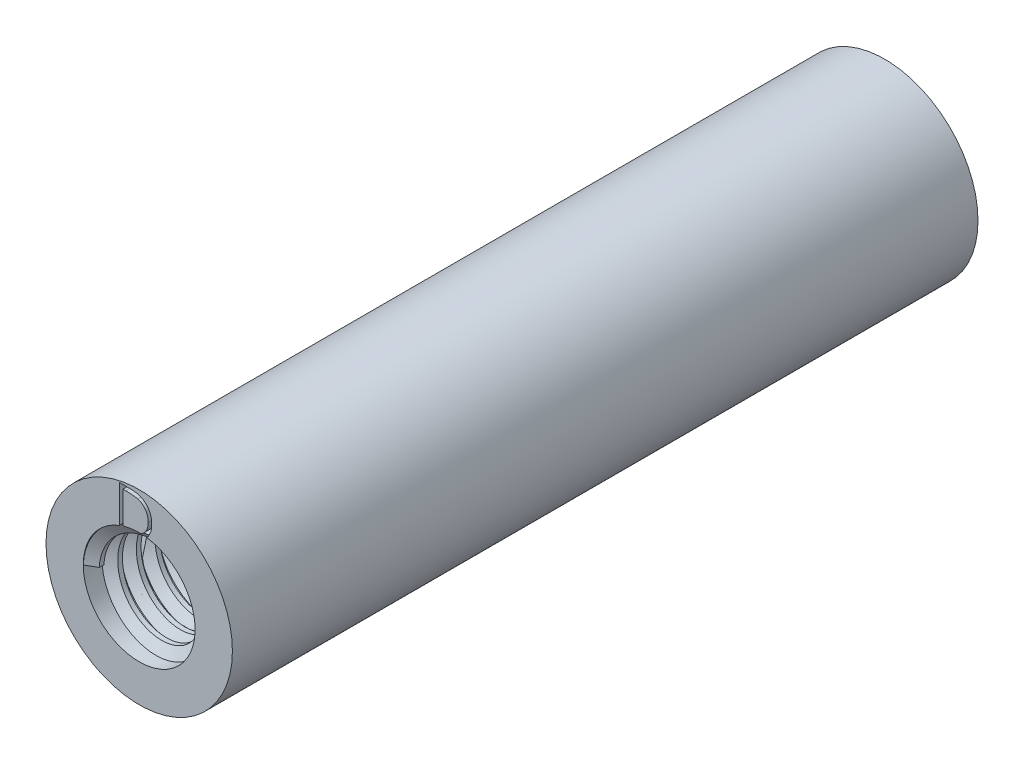
from build123d import *

# Parameters (mm, degrees)
ESQUISSE1_R             = 5
ESQUISSE1_R_2           = 3
BOSS_EXTRU_1_DEPTH      = 40
FILETAGE1_PITCH         = 1
FILETAGE2_PITCH         = 1
ENL_V_MAT_EXTRU_1_DEPTH = 1
ENL_V_MAT_EXTRU_2_DEPTH = 1


with BuildPart() as part:
    # Esquisse1 → Boss.-Extru.1 (new body)
    with BuildSketch(Plane.XY):
        Circle(ESQUISSE1_R)
        Circle(ESQUISSE1_R_2, mode=Mode.SUBTRACT)
    extrude(amount=BOSS_EXTRU_1_DEPTH)

    # Filetage1: the profile of Profil de filetage1 profile screwed along a right-hand helix of 20 turns, 8 arcs to a turn; built about Z, then put on its axis
    filetage1_z = Axis((0, 0, 0), (0, 0, 1))
    filetage1_corners = [(3.0003, 0, -0.000173205), (3.0003, 0, 0.875173202), (2.458734125, 0, 0.562499999), (2.458734125, 0, 0.312499999)]
    with BuildLine(mode=Mode.PRIVATE) as filetage1_profile:
        Line(filetage1_corners[0], filetage1_corners[1])
        Line(filetage1_corners[1], filetage1_corners[2])
        Line(filetage1_corners[2], filetage1_corners[3])
        Line(filetage1_corners[3], filetage1_corners[0])
    filetage1_cap = Face(filetage1_profile.wire())
    filetage1_turn_angles = [0, 22.5, 45, 67.5, 90, 112.5, 135, 157.5, 180, 202.5, 225, 247.5, 270, 292.5, 315, 337.5, 360]
    filetage1_turn_weights = [1, 0.9238795325112867, 1, 0.9238795325112867, 1, 0.9238795325112867, 1, 0.9238795325112867, 1, 0.9238795325112867, 1, 0.9238795325112867, 1, 0.9238795325112867, 1, 0.9238795325112867, 1]
    filetage1_turn_rails = [Edge.make_bspline([Vector(p[0], p[1], 0).rotate(filetage1_z, filetage1_turn_angles[k]) / filetage1_turn_weights[k] + Vector(0, 0, p[2] + FILETAGE1_PITCH * filetage1_turn_angles[k] / 360) for k in range(17)], [0, 0, 0, 1, 1, 2, 2, 3, 3, 4, 4, 5, 5, 6, 6, 7, 7, 8, 8, 8], 2, filetage1_turn_weights) for p in filetage1_corners]
    filetage1_turn_sides = [Face.make_surface_from_curves(filetage1_turn_rails[p[0]], filetage1_turn_rails[p[1]]) for p in [(0, 1), (1, 2), (2, 3), (3, 0)]]
    filetage1 = Plane(origin=(0, 0, 40), x_dir=(-1, 0, 0), z_dir=(0, 0, -1)) * Solid(Shell([*[p.moved(Location((0, 0, FILETAGE1_PITCH * i))) for i in range(20) for p in filetage1_turn_sides], filetage1_cap, filetage1_cap.rotate(filetage1_z, 7200).moved(Location((0, 0, FILETAGE1_PITCH * 7200 / 360)))]))
    add(filetage1)

    # Filetage2: the profile of Profil de filetage2 profile screwed along a left-hand helix of 20 turns, 8 arcs to a turn; built about Z, then put on its axis
    filetage2_z = Axis((0, 0, 0), (0, 0, 1))
    filetage2_corners = [(3.0003, 0, -0.000173205), (3.0003, 0, 0.875173202), (2.458734125, 0, 0.562499999), (2.458734125, 0, 0.312499999)]
    with BuildLine(mode=Mode.PRIVATE) as filetage2_profile:
        Line(filetage2_corners[0], filetage2_corners[1])
        Line(filetage2_corners[1], filetage2_corners[2])
        Line(filetage2_corners[2], filetage2_corners[3])
        Line(filetage2_corners[3], filetage2_corners[0])
    filetage2_cap = Face(filetage2_profile.wire())
    filetage2_turn_angles = [0, -22.5, -45, -67.5, -90, -112.5, -135, -157.5, -180, -202.5, -225, -247.5, -270, -292.5, -315, -337.5, -360]
    filetage2_turn_weights = [1, 0.9238795325112867, 1, 0.9238795325112867, 1, 0.9238795325112867, 1, 0.9238795325112867, 1, 0.9238795325112867, 1, 0.9238795325112867, 1, 0.9238795325112867, 1, 0.9238795325112867, 1]
    filetage2_turn_rails = [Edge.make_bspline([Vector(p[0], p[1], 0).rotate(filetage2_z, filetage2_turn_angles[k]) / filetage2_turn_weights[k] + Vector(0, 0, p[2] + -FILETAGE2_PITCH * filetage2_turn_angles[k] / 360) for k in range(17)], [0, 0, 0, 1, 1, 2, 2, 3, 3, 4, 4, 5, 5, 6, 6, 7, 7, 8, 8, 8], 2, filetage2_turn_weights) for p in filetage2_corners]
    filetage2_turn_sides = [Face.make_surface_from_curves(filetage2_turn_rails[p[0]], filetage2_turn_rails[p[1]]) for p in [(0, 1), (1, 2), (2, 3), (3, 0)]]
    filetage2 = Plane(origin=(0, 0, 0), x_dir=(1, 0, 0), z_dir=(0, 0, 1)) * Solid(Shell([*[p.moved(Location((0, 0, FILETAGE2_PITCH * i))) for i in range(20) for p in filetage2_turn_sides], filetage2_cap, filetage2_cap.rotate(filetage2_z, -7200).moved(Location((0, 0, -FILETAGE2_PITCH * -7200 / 360)))]))
    add(filetage2)

    # Esquisse6 → Enlèv. mat.-Extru.1 (cut)
    with BuildSketch(Plane(origin=(0, 0, 0), x_dir=(-1, 0, 0), z_dir=(0, 0, -1))):
        with BuildLine():
            Line((0.930500833, 4.448494922), (0.76768032, 4.294154645))
            add(Edge.make_bspline(
                [(0.76768032, 4.294154645), (0.738216993, 4.321871405), (0.679992907, 4.376644003), (0.585069332, 4.447710176), (0.486031325, 4.508589198), (0.383395672, 4.55812297), (0.27970407, 4.59764583), (0.176332858, 4.625784277), (0.074342363, 4.643729097), (0.006507902, 4.645875016), (-0.026917703, 4.646932422)],
                knots=[0, 0, 0, 0, 1.08915593, 2.152340314, 3.188132944, 4.216796309, 5.218260357, 6.173443236, 7.099959455, 8, 8, 8, 8], degree=3))
            add(Edge.make_bspline(
                [(-0.026917703, 4.646932422), (-0.047428022, 4.646682289), (-0.088395464, 4.646182672), (-0.149247783, 4.639805932), (-0.209461892, 4.6306348), (-0.268924123, 4.617365188), (-0.327750092, 4.600547329), (-0.385735203, 4.579510406), (-0.442987622, 4.554984139), (-0.498968062, 4.5266435), (-0.553239699, 4.49551045), (-0.604497405, 4.461009666), (-0.653067889, 4.424246922), (-0.698038241, 4.384301805), (-0.73966714, 4.341536149), (-0.778945441, 4.296745483), (-0.814491711, 4.248706089), (-0.846599225, 4.198301829), (-0.875241727, 4.146417981), (-0.900526008, 4.093553935), (-0.92175139, 4.039885033), (-0.938545299, 3.985343929), (-0.952400789, 3.930352572), (-0.962148104, 3.874530193), (-0.967643407, 3.817817022), (-0.96859396, 3.779839632), (-0.969071816, 3.760747861)],
                knots=[0, 0, 0, 0, 1.02818874, 2.053710826, 3.065248034, 4.081641283, 5.106893873, 6.131558223, 7.173050175, 8.228653731, 9.27666206, 10.308777013, 11.325269123, 12.329503258, 13.32196095, 14.316845687, 15.314881793, 16.315733098, 17.311955233, 18.285320748, 19.252783886, 20.203351036, 21.145449891, 22.095197417, 23.042428769, 24, 24, 24, 24], degree=3))
            add(Edge.make_bspline(
                [(-0.969071816, 3.760747861), (-0.968614787, 3.7412317), (-0.967701976, 3.70225267), (-0.961859782, 3.644078159), (-0.951017465, 3.586767654), (-0.936522708, 3.530132831), (-0.918391453, 3.474076695), (-0.895789888, 3.418842273), (-0.869019739, 3.364431607), (-0.838033825, 3.311334953), (-0.804054549, 3.259613887), (-0.765988972, 3.210894557), (-0.725554238, 3.164528201), (-0.68127726, 3.121544287), (-0.634577823, 3.080793073), (-0.584060685, 3.043397305), (-0.530719197, 3.008636666), (-0.474471978, 2.976949247), (-0.415929343, 2.948641228), (-0.35590264, 2.923468681), (-0.294200104, 2.902737844), (-0.231146001, 2.885841943), (-0.166815498, 2.871992715), (-0.100882056, 2.863083072), (-0.033830466, 2.856617665), (0.011368612, 2.856144941), (0.034139989, 2.855906781)],
                knots=[0, 0, 0, 0, 0.93586088, 1.869166235, 2.799637598, 3.729985548, 4.670839027, 5.622275134, 6.589130586, 7.576015415, 8.568469353, 9.55398029, 10.53834874, 11.515998671, 12.510579167, 13.508179873, 14.527009472, 15.561807829, 16.601455013, 17.643573243, 18.680854198, 19.719860599, 20.772568776, 21.833555941, 22.908541556, 24, 24, 24, 24], degree=3))
            add(Edge.make_bspline(
                [(0.034139989, 2.855906781), (0.061583085, 2.856480444), (0.115472062, 2.857606924), (0.194687672, 2.866376147), (0.270768577, 2.880072065), (0.343500995, 2.900129536), (0.412969403, 2.925713187), (0.479428468, 2.956553254), (0.542354947, 2.993832628), (0.601938009, 3.035908252), (0.656824497, 3.08278627), (0.706326753, 3.13337125), (0.749655216, 3.187417652), (0.787455677, 3.244607152), (0.818727101, 3.305413123), (0.844394887, 3.369537577), (0.864069782, 3.437009358), (0.872146362, 3.48363144), (0.876227329, 3.507188833)],
                knots=[0, 0, 0, 0, 1.13008108, 2.219097802, 3.278683437, 4.311054135, 5.322181354, 6.324827112, 7.324222904, 8.330512327, 9.32562643, 10.293043162, 11.24128371, 12.174520618, 13.111833804, 14.052305215, 15.015860969, 16, 16, 16, 16], degree=3))
            Line((0.876227329, 3.507188833), (0.170671773, 3.507188833))
            Line((0.170671773, 3.507188833), (0.170671773, 3.72428285))
            Line((0.170671773, 3.72428285), (1.066184594, 3.72428285))
            add(Edge.make_bspline(
                [(1.066184594, 3.72428285), (1.065152962, 3.683819749), (1.063133871, 3.604626153), (1.048971003, 3.489134608), (1.026101017, 3.380052679), (0.994858829, 3.277265488), (0.954415207, 3.180918696), (0.905204201, 3.090914482), (0.846438204, 3.007834299), (0.780210461, 2.930999902), (0.705885249, 2.862462711), (0.625470893, 2.802224835), (0.538834536, 2.751483729), (0.446058128, 2.710202281), (0.34744539, 2.677984198), (0.242768132, 2.655141388), (0.132168307, 2.641455648), (0.056369459, 2.639707052), (0.017603531, 2.638812764)],
                knots=[0, 0, 0, 0, 1.140356446, 2.231883559, 3.274166699, 4.278491846, 5.25512956, 6.21435461, 7.1637429, 8.11826594, 9.068280886, 10.0076534, 10.945064095, 11.891975133, 12.864533718, 13.863980011, 14.907571808, 16, 16, 16, 16], degree=3))
            add(Edge.make_bspline(
                [(0.017603531, 2.638812764), (-0.006290694, 2.639156947), (-0.053417806, 2.639835787), (-0.123020415, 2.644660183), (-0.190703928, 2.652087007), (-0.256458486, 2.663302391), (-0.32052596, 2.677039349), (-0.382586375, 2.694629888), (-0.442876143, 2.714991435), (-0.501488449, 2.7381512), (-0.557891294, 2.764985487), (-0.612335902, 2.794806079), (-0.665123225, 2.827459206), (-0.715893692, 2.863509575), (-0.764911834, 2.902687539), (-0.811861583, 2.945071623), (-0.857005776, 2.990532253), (-0.885284723, 3.022813844), (-0.899533889, 3.039079858)],
                knots=[0, 0, 0, 0, 1.107784379, 2.184907829, 3.233506516, 4.263428166, 5.276301166, 6.270063455, 7.25232949, 8.225834625, 9.190232166, 10.146266622, 11.1027726, 12.066435141, 13.031522626, 14.010570082, 14.99756817, 16, 16, 16, 16], degree=3))
            add(Edge.make_bspline(
                [(-0.899533889, 3.039079858), (-0.920208238, 3.064885444), (-0.961213764, 3.116068268), (-1.013996268, 3.198073949), (-1.058991402, 3.282983645), (-1.095499562, 3.37103373), (-1.12400688, 3.462141845), (-1.144451614, 3.556191568), (-1.156430308, 3.653304012), (-1.158156019, 3.719020624), (-1.159029081, 3.752267625)],
                knots=[0, 0, 0, 0, 1.023165419, 2.029347347, 3.013907458, 3.994755782, 4.975994455, 5.96558838, 6.970761222, 8, 8, 8, 8], degree=3))
            add(Edge.make_bspline(
                [(-1.159029081, 3.752267625), (-1.158707204, 3.777163407), (-1.15806754, 3.826638559), (-1.150311157, 3.900091312), (-1.13918268, 3.972239826), (-1.122825652, 4.043025124), (-1.10220553, 4.112494482), (-1.076470803, 4.180680155), (-1.046507937, 4.247622383), (-1.011682423, 4.312860388), (-0.972926583, 4.375528486), (-0.930865259, 4.435374395), (-0.884901177, 4.491308258), (-0.835784955, 4.544038446), (-0.782930585, 4.59290251), (-0.726833219, 4.638352854), (-0.667449626, 4.680450442), (-0.604592984, 4.718532199), (-0.53920148, 4.752739722), (-0.47143186, 4.782729388), (-0.401304812, 4.807514536), (-0.329345718, 4.828544393), (-0.255009896, 4.844095931), (-0.178836786, 4.855373982), (-0.100429337, 4.863091106), (-0.047430405, 4.863711747), (-0.020557527, 4.86402644)],
                knots=[0, 0, 0, 0, 1.008945113, 2.00506715, 2.99143336, 3.967273523, 4.948097931, 5.927297278, 6.919902385, 7.919676788, 8.923139349, 9.905703106, 10.883022732, 11.856032218, 12.825136022, 13.798837087, 14.781400844, 15.773989409, 16.776158564, 17.77167057, 18.775803737, 19.789618931, 20.80898985, 21.851988756, 22.910860228, 24, 24, 24, 24], degree=3))
            add(Edge.make_bspline(
                [(-0.020557527, 4.86402644), (0.001357982, 4.863675985), (0.044813862, 4.862981075), (0.109478471, 4.858164359), (0.17314358, 4.850529917), (0.235903587, 4.840111812), (0.297544771, 4.825921866), (0.358242731, 4.808941189), (0.418085455, 4.789170421), (0.476885396, 4.765591452), (0.53503792, 4.738828545), (0.592866366, 4.708703285), (0.650173148, 4.674700544), (0.707057647, 4.636719358), (0.76387857, 4.595412053), (0.819737187, 4.549597212), (0.875981825, 4.501081545), (0.912147684, 4.466197558), (0.930500833, 4.448494922)],
                knots=[0, 0, 0, 0, 0.985871117, 1.954866573, 2.915460327, 3.869826059, 4.81536089, 5.759505086, 6.70452669, 7.649098992, 8.607881297, 9.583363685, 10.581137262, 11.603961102, 12.659522466, 13.73993555, 14.853081303, 16, 16, 16, 16], degree=3))
        make_face()
    extrude(amount=-ENL_V_MAT_EXTRU_1_DEPTH, mode=Mode.SUBTRACT)

    # Esquisse7 → Enlèv. mat.-Extru.2 (cut)
    with BuildSketch(Plane.XY.offset(40)):
        with BuildLine():
            Line((-1.063858985, 2.686479141), (-1.063858985, 4.803145808))
            Line((-1.063858985, 4.803145808), (-0.636455139, 4.803145808))
            add(Edge.make_bspline(
                [(-0.636455139, 4.803145808), (-0.599281037, 4.802878158), (-0.527460865, 4.802361061), (-0.423676194, 4.79908241), (-0.327649823, 4.793282462), (-0.23969757, 4.784834224), (-0.15957798, 4.774460723), (-0.087515394, 4.761458098), (-0.023137193, 4.746104299), (0.016456231, 4.733013956), (0.035179476, 4.726823692)],
                knots=[0, 0, 0, 0, 1.314313732, 2.53924729, 3.670748893, 4.714932338, 5.66265055, 6.526160246, 7.303039223, 8, 8, 8, 8], degree=3))
            add(Edge.make_bspline(
                [(0.035179476, 4.726823692), (0.059669152, 4.717491789), (0.108093158, 4.6990396), (0.177040323, 4.664231742), (0.241946614, 4.624793342), (0.303160097, 4.580672416), (0.359282501, 4.530619691), (0.412506325, 4.476761358), (0.460654277, 4.417138885), (0.504746437, 4.352988774), (0.544500859, 4.285066723), (0.579056445, 4.213502157), (0.607754813, 4.138658512), (0.631578335, 4.060743923), (0.65035405, 3.979587066), (0.663164076, 3.895093442), (0.671613198, 3.80759698), (0.672462315, 3.748224804), (0.672893151, 3.718099734)],
                knots=[0, 0, 0, 0, 0.984719456, 1.947108742, 2.898477687, 3.838006223, 4.779231079, 5.722358779, 6.681677486, 7.655904652, 8.64651281, 9.637519902, 10.640069247, 11.656948941, 12.698408672, 13.768548281, 14.867775369, 16, 16, 16, 16], degree=3))
            add(Edge.make_bspline(
                [(0.672893151, 3.718099734), (0.672512776, 3.691936985), (0.671763206, 3.640380556), (0.66503262, 3.564397728), (0.655249798, 3.490669045), (0.640104021, 3.419545597), (0.621717739, 3.350404247), (0.598153704, 3.283981889), (0.571159857, 3.219669205), (0.539682073, 3.158335779), (0.50512514, 3.100228215), (0.468040086, 3.045451586), (0.428466465, 2.994787524), (0.386026916, 2.948082601), (0.341269868, 2.905407228), (0.293902297, 2.866404914), (0.243801976, 2.831838807), (0.191193301, 2.800350603), (0.134541546, 2.772882102), (0.072773665, 2.749641096), (0.005626239, 2.730381477), (-0.066735916, 2.714312411), (-0.144437829, 2.701565661), (-0.22755568, 2.693022557), (-0.315961764, 2.687245308), (-0.37666732, 2.686739489), (-0.407912805, 2.686479141)],
                knots=[0, 0, 0, 0, 1.105936401, 2.179363191, 3.223086493, 4.248585256, 5.251745608, 6.245858792, 7.225916811, 8.198733463, 9.158002045, 10.082870192, 10.993790845, 11.873723703, 12.748670949, 13.606408763, 14.465103618, 15.319838547, 16.196477973, 17.123216899, 18.106603292, 19.147568657, 20.255746949, 21.433717677, 22.679120308, 24, 24, 24, 24], degree=3))
            Line((-0.407912805, 2.686479141), (-1.063858985, 2.686479141))
        make_face()
        with BuildLine():
            Line((-0.873901721, 2.903573158), (-0.630942987, 2.903573158))
            add(Edge.make_bspline(
                [(-0.630942987, 2.903573158), (-0.596031067, 2.903723197), (-0.52888266, 2.904011778), (-0.432327586, 2.906544039), (-0.344105284, 2.910681782), (-0.264203229, 2.916472424), (-0.192666533, 2.92413392), (-0.129345694, 2.932676123), (-0.074448276, 2.943318391), (-0.041229045, 2.952964924), (-0.025878216, 2.957422651)],
                knots=[0, 0, 0, 0, 1.375205317, 2.645023457, 3.804390687, 4.853969522, 5.800190428, 6.637939096, 7.370582563, 8, 8, 8, 8], degree=3))
            add(Edge.make_bspline(
                [(-0.025878216, 2.957422651), (-0.006557064, 2.964227164), (0.031623755, 2.977673666), (0.086585174, 3.002201395), (0.137842981, 3.031255408), (0.186290473, 3.063551069), (0.231240402, 3.100227461), (0.273225463, 3.140487059), (0.312161124, 3.184534756), (0.34764511, 3.232315883), (0.379400132, 3.283533045), (0.406899399, 3.33768272), (0.431000088, 3.394171601), (0.449916189, 3.45386714), (0.46474228, 3.516235665), (0.475243782, 3.581281566), (0.481784115, 3.648992693), (0.482546991, 3.695046597), (0.482935886, 3.718523746)],
                knots=[0, 0, 0, 0, 0.998632004, 1.973411704, 2.929992603, 3.868527914, 4.809262121, 5.754881198, 6.702106254, 7.672490631, 8.653608572, 9.636854334, 10.631411391, 11.644891563, 12.686317036, 13.754757253, 14.855430412, 16, 16, 16, 16], degree=3))
            add(Edge.make_bspline(
                [(0.482935886, 3.718523746), (0.48262547, 3.743278755), (0.482015653, 3.791910191), (0.474350713, 3.863266468), (0.463149582, 3.931895243), (0.446951829, 3.997801104), (0.426310774, 4.061112631), (0.400551157, 4.121479668), (0.37111944, 4.179539755), (0.336101707, 4.233952824), (0.297750372, 4.285413895), (0.255188512, 4.332558058), (0.209092327, 4.375492706), (0.159964585, 4.414886481), (0.10642072, 4.449154514), (0.049722059, 4.479807888), (-0.01096318, 4.50582226), (-0.053183239, 4.519658525), (-0.074639568, 4.526690145)],
                knots=[0, 0, 0, 0, 1.122418816, 2.205001699, 3.251619955, 4.274784885, 5.280384055, 6.268708349, 7.249350384, 8.229342522, 9.199999885, 10.157847722, 11.105861043, 12.055065948, 13.010012805, 13.98527497, 14.976112212, 16, 16, 16, 16], degree=3))
            add(Edge.make_bspline(
                [(-0.074639568, 4.526690145), (-0.092390023, 4.531598652), (-0.130132361, 4.542035483), (-0.191720989, 4.553420351), (-0.261035865, 4.56346212), (-0.338384732, 4.571963886), (-0.423679419, 4.578064314), (-0.516985526, 4.582643157), (-0.618343382, 4.585731453), (-0.688606152, 4.585942338), (-0.725073596, 4.586051791)],
                knots=[0, 0, 0, 0, 0.674548936, 1.434276114, 2.292660221, 3.240891867, 4.284742987, 5.42552168, 6.663806718, 8, 8, 8, 8], degree=3))
            Line((-0.725073596, 4.586051791), (-0.873901721, 4.586051791))
            Line((-0.873901721, 4.586051791), (-0.873901721, 2.903573158))
        make_face(mode=Mode.SUBTRACT)
    extrude(amount=-ENL_V_MAT_EXTRU_2_DEPTH, mode=Mode.SUBTRACT)


solid = part.part
